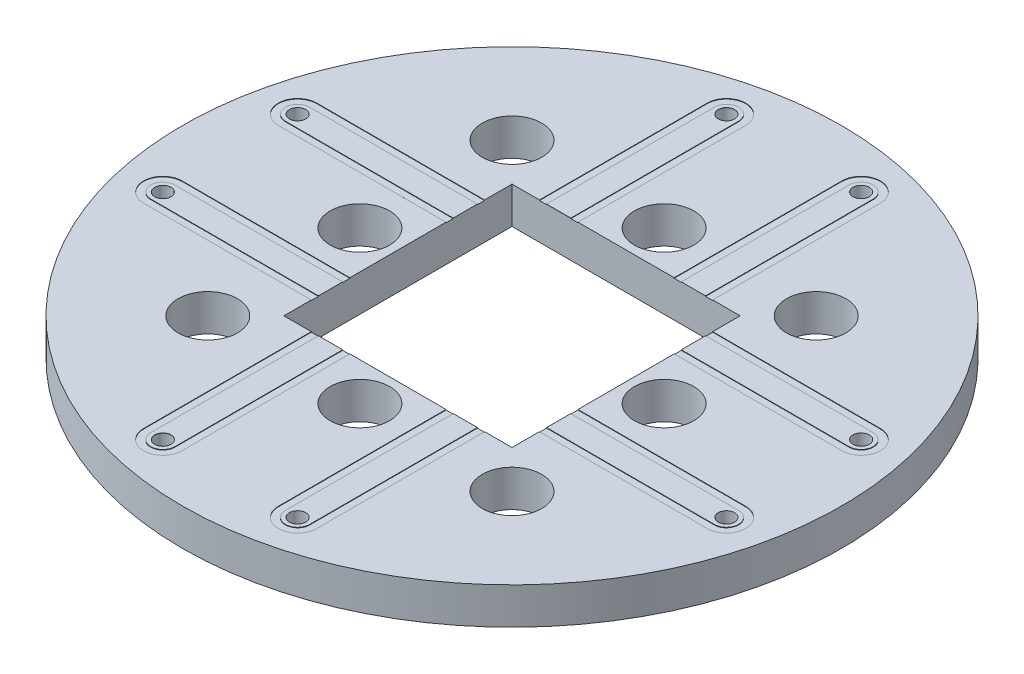
from build123d import *

# Parameters (mm, degrees)
BODAY_SKETCH_R    = 11.557
BODY_DEPTH        = 1.27
COPPER_START      = 0.017500092
COPPER_SKETCH_R   = 11.557
COPPER_DEPTH      = 0.017500092
GAP_CUT_DEPTH     = 17.39333395
CENTER_DEPTH      = 0.017500092
IO_HOLE_SKETCH_R  = 0.287000061
IO_HOLE_DEPTH     = 17.39333395
GAP_CUTS_COUNT    = 4
CENTERS_COUNT     = 4
IO_HOLES_COUNT    = 4
POCKET_DEPTH      = 17.39333395
POCKET_DEPTH_BACK = 17.39333395
POCKET_SKETCH_W   = 8.000000002
POCKET_SKETCH_H   = 8.000000002
POSTS_R           = 1.0414
POST_CUT_DEPTH    = 17.39333395
POST_CUTS_COUNT   = 4


with BuildPart() as part:
    # Boday Sketch → Body (new body)
    with BuildSketch(Plane(origin=(0, 0, 0), x_dir=(1, 0, 0), z_dir=(0, 1, 0))):
        Circle(BODAY_SKETCH_R)
    extrude(amount=-BODY_DEPTH)

    # Copper Sketch → Copper (add)
    with BuildSketch(Plane(origin=(0, 0, 0), x_dir=(1, 0, 0), z_dir=(0, 1, 0)).offset(COPPER_START)):
        Circle(COPPER_SKETCH_R)
    extrude(amount=-COPPER_DEPTH)

    # Gap → Gap Cut (cut, through all)
    with BuildSketch(Plane(origin=(0, 0, 0), x_dir=(1, 0, 0), z_dir=(0, 1, 0))):
        with BuildLine():
            Line((-3.037200047, 9.881579386), (-3.037200047, -9.881579386))
            ThreePointArc((-3.037200047, -9.881579386), (-2.3622, -10.556579433), (-1.687199953, -9.881579386))
            Line((-1.687199953, -9.881579386), (-1.687199953, 9.881579386))
            ThreePointArc((-1.687199953, 9.881579386), (-2.3622, 10.556579433), (-3.037200047, 9.881579386))
        make_face()
    gap_cut = extrude(amount=GAP_CUT_DEPTH, mode=Mode.SUBTRACT)


with BuildPart() as body_2:
    # Center Sketch → Center (new body)
    with BuildSketch(Plane(origin=(0, 0, 0), x_dir=(1, 0, 0), z_dir=(0, 1, 0))):
        with BuildLine():
            Line((-2.787200039, 9.881579386), (-2.787200039, -9.881579386))
            ThreePointArc((-2.787200039, -9.881579386), (-2.3622, -10.306579425), (-1.937199961, -9.881579386))
            Line((-1.937199961, -9.881579386), (-1.937199961, 9.881579386))
            ThreePointArc((-1.937199961, 9.881579386), (-2.3622, 10.306579425), (-2.787200039, 9.881579386))
        make_face()
    center = extrude(amount=CENTER_DEPTH)


with BuildPart() as io_hole_tool:
    # IO Hole Sketch → IO Hole (new, symmetric)
    with BuildSketch(Plane(origin=(0, 0, 0), x_dir=(1, 0, 0), z_dir=(0, 1, 0))):
        with Locations((-2.3622, 9.881579386)):
            Circle(IO_HOLE_SKETCH_R)
        with Locations((-2.3622, -9.881579386)):
            Circle(IO_HOLE_SKETCH_R)
    io_hole = extrude(amount=IO_HOLE_DEPTH, both=True)


with BuildPart() as part_1:
    add(part.part)

    # IO Hole: cut by io_hole_tool
    add(io_hole_tool.part, mode=Mode.SUBTRACT)

    # Gap Cuts: Gap Cut ×4 about axis
    gap_cuts_axis = Axis((0, 0.0762, 0), (0, -1, 0))
    for i in range(1, GAP_CUTS_COUNT):
        add(gap_cut.rotate(gap_cuts_axis, i * 360 / GAP_CUTS_COUNT), mode=Mode.SUBTRACT)

    # Centers: Center ×4 about axis
    centers_axis = Axis((0, 0.0762, 0), (0, -1, 0))
    for i in range(1, CENTERS_COUNT):
        add(center.rotate(centers_axis, i * 360 / CENTERS_COUNT))

    # IO Holes: IO Hole ×4 about axis
    io_holes_axis = Axis((0, 0.0762, 0), (0, -1, 0))
    for i in range(1, IO_HOLES_COUNT):
        add(io_hole.rotate(io_holes_axis, i * 360 / IO_HOLES_COUNT), mode=Mode.SUBTRACT)


with BuildPart() as body_2_1:
    add(body_2.part)

    # IO Hole: cut by io_hole_tool
    add(io_hole_tool.part, mode=Mode.SUBTRACT)


with BuildPart() as pocket_tool:
    # Pocket Sketch → Pocket (new, two sides: drawn at the far end of the back side and taken through both)
    with BuildSketch(Plane(origin=(0, 0, 0), x_dir=(1, 0, 0), z_dir=(0, 1, 0)).offset(-POCKET_DEPTH_BACK)):
        Rectangle(POCKET_SKETCH_W, POCKET_SKETCH_H)
    extrude(amount=POCKET_DEPTH + POCKET_DEPTH_BACK)


with BuildPart() as part_2:
    add(part_1.part)

    # Pocket: cut by pocket_tool
    add(pocket_tool.part, mode=Mode.SUBTRACT)

    # Posts → Post Cut (cut, symmetric)
    with BuildSketch(Plane(origin=(0, 0, 0), x_dir=(1, 0, 0), z_dir=(0, 1, 0))):
        with Locations((0, 5.334)):
            Circle(POSTS_R)
        with Locations((-5.334, 5.334)):
            Circle(POSTS_R)
    post_cut = extrude(amount=POST_CUT_DEPTH, both=True, mode=Mode.SUBTRACT)

    # Post Cuts: Post Cut ×4 about axis
    post_cuts_axis = Axis((0, 0.0762, 0), (0, -1, 0))
    for i in range(1, POST_CUTS_COUNT):
        add(post_cut.rotate(post_cuts_axis, i * 360 / POST_CUTS_COUNT), mode=Mode.SUBTRACT)


with BuildPart() as body_2_2:
    add(body_2_1.part)

    # Pocket: cut by pocket_tool
    add(pocket_tool.part, mode=Mode.SUBTRACT)


solid = Compound([part_2.part, body_2_2.part])
